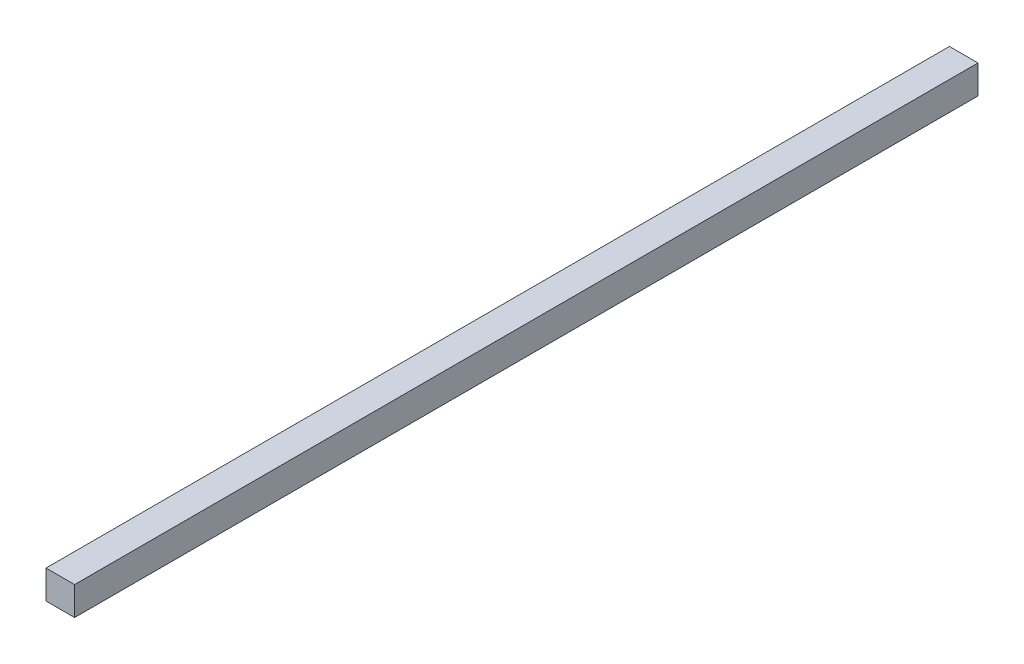
from build123d import *

# Parameters (mm, degrees)
SKETCH1_W           = 3.175
SKETCH1_H           = 3.175
BOSS_EXTRUDE1_DEPTH = 100.33


with BuildPart() as part:
    # Sketch1 → Boss-Extrude1 (new body)
    with BuildSketch(Plane.XY):
        Rectangle(SKETCH1_W, SKETCH1_H)
    extrude(amount=BOSS_EXTRUDE1_DEPTH)


solid = part.part
